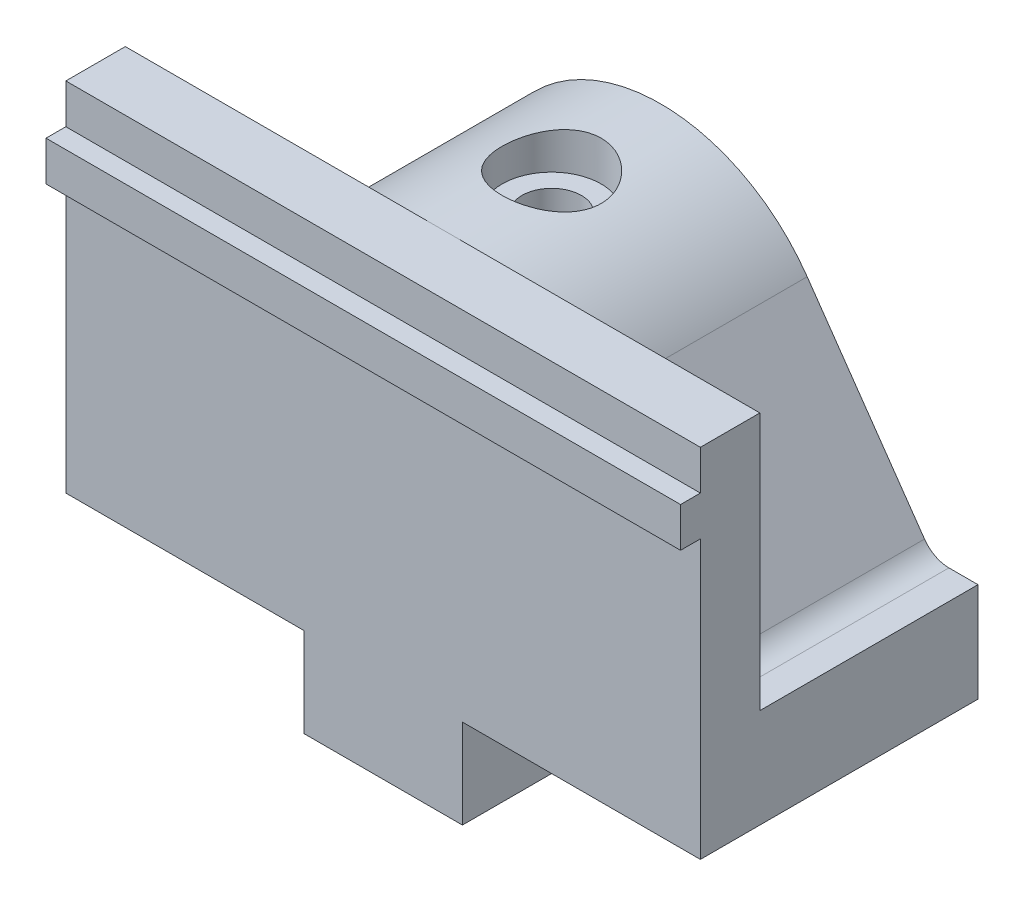
from build123d import *

# Parameters (mm, degrees)
BOSS_EXTRUDE2_DEPTH       = 28
SKETCH5_R                 = 6
CUT_EXTRUDE1_DEPTH        = 24
CUT_EXTRUDE3_DEPTH        = 22
HOLE1_START               = 23.196151292
HOLE1_OUTLINE_R           = 3
HOLE1_DEPTH               = 12.803848708
HOLE1_START_2             = 32
HOLE1_2_OUTLINE_R         = 5
HOLE1_2_OUTLINE_R_2       = 3
HOLE1_2_DEPTH             = 4
F_6_0MM_DOWEL_HOLE2_D     = 6
F_6_0MM_DOWEL_HOLE2_DEPTH = 16
F_6_0MM_DOWEL_HOLE2_TIP   = 1.802581857
FILLET1_R                 = 3
SKETCH19_W                = 64
SKETCH19_H                = 4
BOSS_EXTRUDE3_DEPTH       = 2


# Read off the part's stored shape, not the designer's step: Hole1
with BuildPart() as part:
    # Sketch2 → Boss-Extrude2 (new body)
    with BuildSketch(Plane.XY):
        Polygon((0, -9), (-8, -9), (-8, 0), (-32, 0), (-32, 36), (32, 36), (32, 0), (8, 0), (8, -9), align=None)
    extrude(amount=BOSS_EXTRUDE2_DEPTH)

    # Sketch5 → Cut-Extrude1 (cut)
    with BuildSketch(Plane.XY):
        with Locations((0, 18)):
            Circle(SKETCH5_R)
    extrude(amount=CUT_EXTRUDE1_DEPTH, mode=Mode.SUBTRACT)

    # Sketch6 → Cut-Extrude3 (cut)
    with BuildSketch(Plane(origin=(0, 0, 0), x_dir=(-1, 0, 0), z_dir=(0, 0, -1))):
        with BuildLine():
            Line((-32, 36), (-32, 10))
            Line((-32, 10), (-27.5, 10))
            Line((-27.5, 10), (-14.77335007, 28.283390866))
            ThreePointArc((-14.77335007, 28.283390866), (-8.333635583, 33.954639387), (2.5e-08, 36))
            Line((2.5e-08, 36), (-32, 36))
        make_face()
        with BuildLine():
            Line((32, 36), (2.5e-08, 36))
            ThreePointArc((2.5e-08, 36), (8.333635604, 33.954639376), (14.77335007, 28.283390866))
            Line((14.77335007, 28.283390866), (27.5, 10))
            Line((27.5, 10), (32, 10))
            Line((32, 10), (32, 36))
        make_face()
    extrude(amount=-CUT_EXTRUDE3_DEPTH, mode=Mode.SUBTRACT)

    # Hole1 outline → Hole1 (cut)
    with BuildSketch(Plane(origin=(0, 0, 0), x_dir=(1, 0, 0), z_dir=(0, 1, 0)).offset(HOLE1_START)):
        with Locations((0, -11)):
            Circle(HOLE1_OUTLINE_R)
    extrude(amount=HOLE1_DEPTH, mode=Mode.SUBTRACT)

    # Hole1 2 outline → Hole1 2 (cut)
    with BuildSketch(Plane(origin=(0, 0, 0), x_dir=(1, 0, 0), z_dir=(0, 1, 0)).offset(HOLE1_START_2)):
        with Locations((0, -11)):
            Circle(HOLE1_2_OUTLINE_R)
        with Locations((0, -11)):
            Circle(HOLE1_2_OUTLINE_R_2, mode=Mode.SUBTRACT)
    extrude(amount=HOLE1_2_DEPTH, mode=Mode.SUBTRACT)

    # Ø6.0mm Dowel Hole2
    with Locations(Plane(origin=(0, -9, 0), x_dir=(-1, 0, 0), z_dir=(0, -1, 0))):
        with Locations((0, -20), (0, -8)):
            Hole(F_6_0MM_DOWEL_HOLE2_D / 2, depth=F_6_0MM_DOWEL_HOLE2_DEPTH)
            with Locations((0, 0, -(F_6_0MM_DOWEL_HOLE2_DEPTH + F_6_0MM_DOWEL_HOLE2_TIP / 2))):  # 118° drill point
                Cone(0, F_6_0MM_DOWEL_HOLE2_D / 2, F_6_0MM_DOWEL_HOLE2_TIP, mode=Mode.SUBTRACT)

    # Fillet1
    fillet1_edges = [part.edges().sort_by_distance(p)[0] for p in [
        (27.5, 10, 11),
        (-27.5, 10, 11),
    ]]
    fillet(fillet1_edges, radius=FILLET1_R)

    # Sketch19 → Boss-Extrude3 (add)
    with BuildSketch(Plane.XY.offset(28)):
        with Locations((0, 30)):
            Rectangle(SKETCH19_W, SKETCH19_H)
    extrude(amount=BOSS_EXTRUDE3_DEPTH)


solid = part.part
